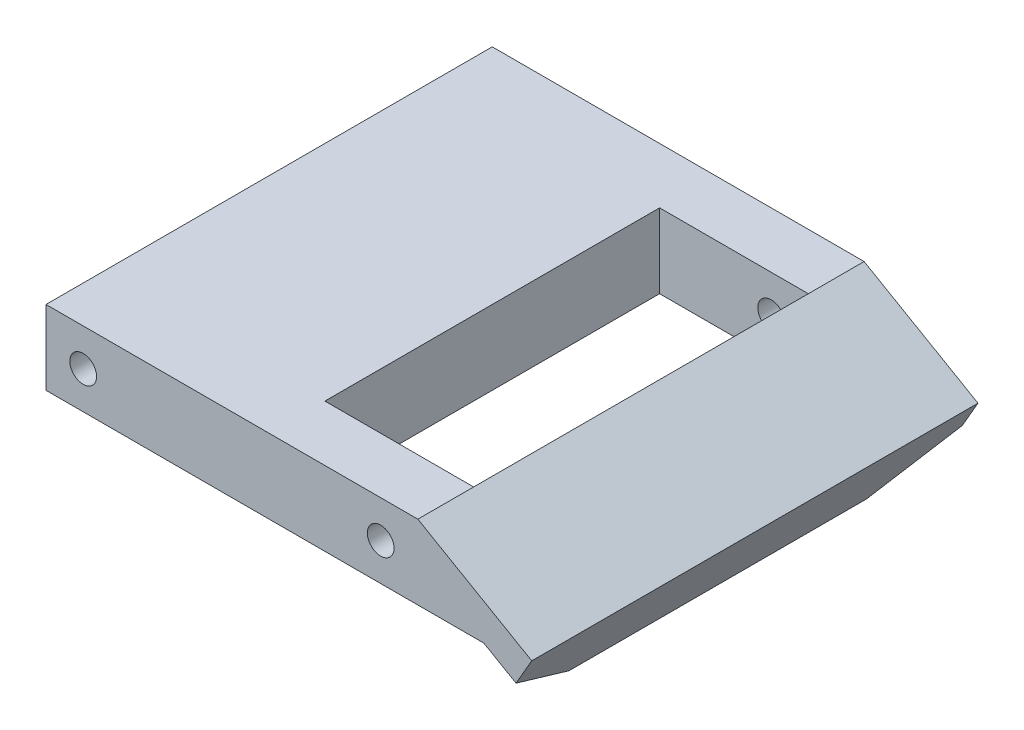
from build123d import *

# Parameters (mm, degrees)
BOSS_EXTRUDE1_DEPTH = 76.2
SKETCH2_R           = 2.286
CUT_EXTRUDE1_DEPTH  = 12.7
CUT_EXTRUDE2_REACH  = 110.647
SKETCH5_R           = 2.286
CUT_EXTRUDE4_DEPTH  = 115.805205961
SKETCH6_W           = 25.4
SKETCH6_H           = 57.15
CUT_EXTRUDE5_DEPTH  = 115.805205961


with BuildPart() as part:
    # Sketch1 → Boss-Extrude1 (new body)
    with BuildSketch(Plane.XY):
        Polygon((0, 0), (63.5, 0), (82.944829198, -11.226477372), (76.594829198, -22.225), (60.097045256, -12.7), (0, -12.7), align=None)
    extrude(amount=BOSS_EXTRUDE1_DEPTH)

    # Sketch2 → Cut-Extrude1 (cut)
    with BuildSketch(Plane(origin=(0, 0, 0), x_dir=(-1, 0, 0), z_dir=(0, 0, -1))):
        with Locations((-6.35, -6.35)):
            Circle(SKETCH2_R)
    extrude(amount=-CUT_EXTRUDE1_DEPTH, mode=Mode.SUBTRACT)

    # Cut-Extrude2: up to this plane
    cut_extrude2_end = Plane(origin=(60.097045256, -12.7, 76.2), z_dir=(0, 1, 0))
    # Sketch3 → Cut-Extrude2 (cut, up to the surface)
    with BuildSketch(Plane(origin=(67.069829198, -38.722783942, 0), x_dir=(0, 0, -1), z_dir=(0.8660254037844377, -0.5000000000000018, 0)), mode=Mode.PRIVATE) as cut_extrude2_sk1:
        Polygon((-76.2, 26.382348419), (-63.5, 19.05), (-76.2, 19.05), align=None)
    cut_extrude2_tool1 = split(extrude(cut_extrude2_sk1.sketch, amount=-CUT_EXTRUDE2_REACH, mode=Mode.PRIVATE), bisect_by=cut_extrude2_end, keep=Keep.BOTH, mode=Mode.PRIVATE)
    add(cut_extrude2_tool1.solids().sort_by_distance((77.816887, -20.108333, 71.966667))[0], mode=Mode.SUBTRACT)
    # Sketch3 → Cut-Extrude2 (cut, up to the surface)
    with BuildSketch(Plane(origin=(67.069829198, -38.722783942, 0), x_dir=(0, 0, -1), z_dir=(0.8660254037844377, -0.5000000000000018, 0)), mode=Mode.PRIVATE) as cut_extrude2_sk2:
        Polygon((-12.7, 19.05), (0, 19.05), (0, 26.382348419), align=None)
    cut_extrude2_tool2 = split(extrude(cut_extrude2_sk2.sketch, amount=-CUT_EXTRUDE2_REACH, mode=Mode.PRIVATE), bisect_by=cut_extrude2_end, keep=Keep.BOTH, mode=Mode.PRIVATE)
    add(cut_extrude2_tool2.solids().sort_by_distance((77.816887, -20.108333, 4.233333))[0], mode=Mode.SUBTRACT)

    # Sketch5 → Cut-Extrude4 (cut, through all)
    with BuildSketch(Plane.XY.offset(76.2)):
        with Locations((6.35, -6.35)):
            Circle(SKETCH5_R)
        with Locations((57.15, -6.35)):
            Circle(SKETCH5_R)
    extrude(amount=-CUT_EXTRUDE4_DEPTH, mode=Mode.SUBTRACT)

    # Sketch6 → Cut-Extrude5 (cut, through all)
    with BuildSketch(Plane(origin=(0, 0, 0), x_dir=(1, 0, 0), z_dir=(0, 1, 0))):
        with Locations((50.8, -38.1)):
            Rectangle(SKETCH6_W, SKETCH6_H)
    extrude(amount=-CUT_EXTRUDE5_DEPTH, mode=Mode.SUBTRACT)


solid = part.part
